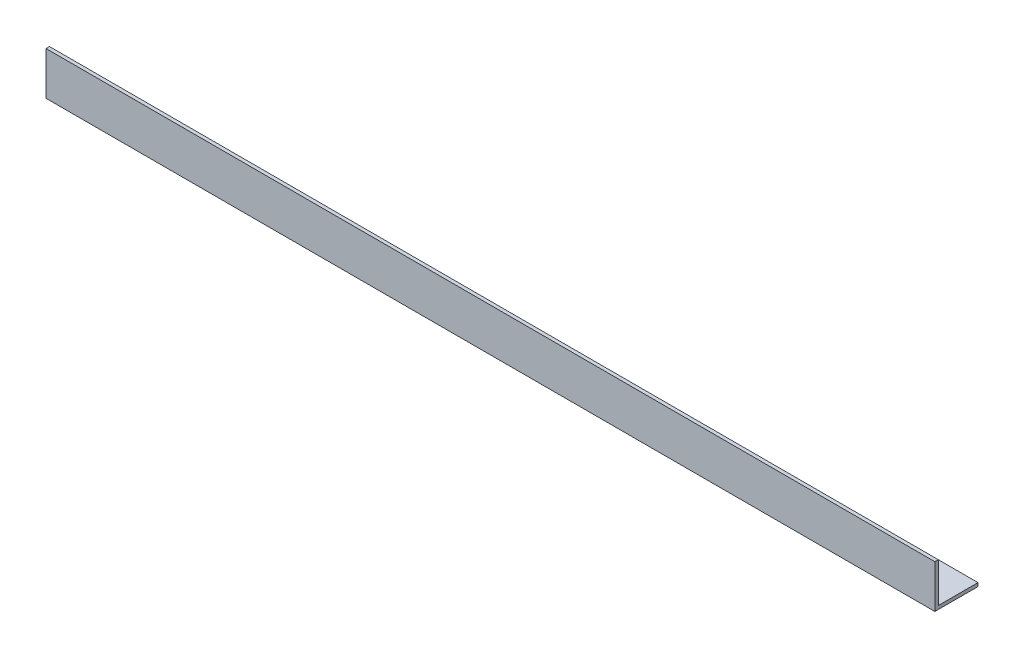
from build123d import *

# Parameters (mm, degrees)
EXTRUDE_1_DEPTH = 515


with BuildPart() as part:
    # Эскиз1 → Вытянуть-Тонкостенный1 (new body)
    with BuildSketch(Plane(origin=(0, 0, 0), x_dir=(0, 0, -1), z_dir=(1, 0, 0))):
        Polygon((0, 25), (0, 0), (25, 0), (25, 2), (2, 2), (2, 25), align=None)
    extrude(amount=EXTRUDE_1_DEPTH)


solid = part.part
